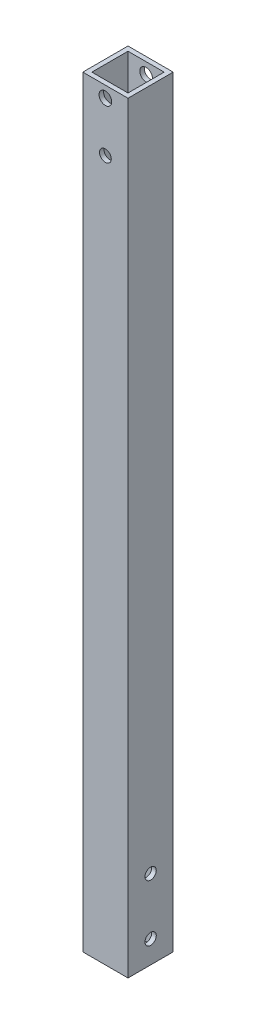
from build123d import *

# Parameters (mm, degrees)
ESBO_O1_W             = 20
ESBO_O1_H             = 20
ESBO_O1_W_2           = 16
ESBO_O1_H_2           = 16
EXTRUS_O_FINA1_DEPTH  = 337
ESBO_O2_R             = 2.5
CORTE_EXTRUS_O1_DEPTH = 339.18486069
ESBO_O3_R             = 2.6
ESBO_O3_R_2           = 2.8
CORTE_EXTRUS_O2_DEPTH = 339.18486069


with BuildPart() as part:
    # Esboço1 → Extrusão-Fina1 (new body)
    with BuildSketch(Plane(origin=(0, 0, 0), x_dir=(1, 0, 0), z_dir=(0, 1, 0))):
        with Locations((10, 10)):
            Rectangle(ESBO_O1_W, ESBO_O1_H)
        with Locations((10, 10)):
            Rectangle(ESBO_O1_W_2, ESBO_O1_H_2, mode=Mode.SUBTRACT)
    extrude(amount=EXTRUS_O_FINA1_DEPTH)

    # Esboço2 → Corte-extrusão1 (cut, through all)
    with BuildSketch(Plane.ZY):
        with Locations((-10, 35)):
            Circle(ESBO_O2_R)
        with Locations((-10, 10)):
            Circle(ESBO_O2_R)
    extrude(amount=-CORTE_EXTRUS_O1_DEPTH, mode=Mode.SUBTRACT)

    # Esboço3 → Corte-extrusão2 (cut, through all)
    with BuildSketch(Plane(origin=(0, 0, -20), x_dir=(-1, 0, 0), z_dir=(0, 0, -1))):
        with Locations((-10, 310)):
            Circle(ESBO_O3_R)
        with Locations((-10, 332)):
            Circle(ESBO_O3_R_2)
    extrude(amount=-CORTE_EXTRUS_O2_DEPTH, mode=Mode.SUBTRACT)


solid = part.part
